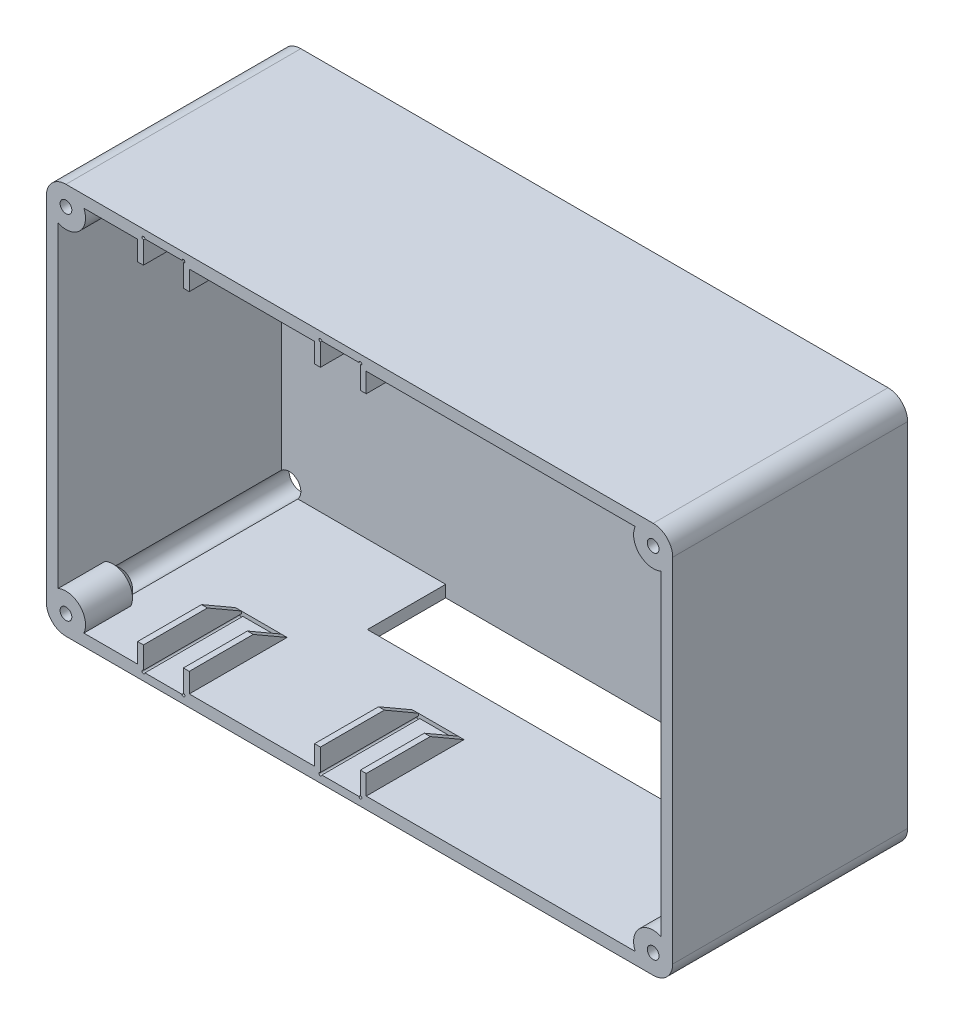
from build123d import *
from OCP.BRepFilletAPI import BRepFilletAPI_MakeChamfer

# Parameters (mm, degrees)
BASESHAPE_W                = 160
BASESHAPE_H                = 100
CONTAINERBASE_DEPTH        = 60
SIDECORNERFILLET_R         = 5
CONTAINERSHELL_T           = -3
SLOTSKETCH_W               = 10.2
SLOTSKETCH_H               = 25
SLOTCUT_DEPTH              = 1
VIEWELECTRONICSHOLE_REACH  = 199.99
ELECTRONICSVIEWHOLE_W      = 100
ELECTRONICSVIEWHOLE_H      = 20
SCREWSUPPORTS_R            = 5
BOSS_EXTRUDE3_DEPTH        = 15
SCREWSUPPORTTAPER_SIZE     = 3
SKETCH5_R                  = 3
COUNTERSINKCUT_DEPTH       = 52
SKETCH6_R                  = 1.5
SCREWHOLES_DEPTH           = 52
SKETCH7_W                  = 1.5
SKETCH7_H                  = 25
BOSS_EXTRUDE4_DEPTH        = 5
CHAMFER1_SIZE              = 8.660254038
CHAMFER1_SIZE_2            = 5
CHAMFER1_OF_MIRROR3_SIZE   = 5
CHAMFER1_OF_MIRROR3_SIZE_2 = 8.660254038
SKETCH8_R                  = 0.375
CUT_EXTRUDE1_DEPTH         = 25


with BuildPart() as part:
    # BaseShape → ContainerBase (new body)
    with BuildSketch(Plane.XY):
        with Locations((-80, -50)):
            Rectangle(BASESHAPE_W, BASESHAPE_H)
    extrude(amount=CONTAINERBASE_DEPTH)

    # SideCornerFillet
    sidecornerfillet_edges = [part.edges().sort_by_distance(p)[0] for p in [
        (0, -100, 30),
        (-160, -100, 30),
        (-160, 0, 30),
        (0, 0, 30),
    ]]
    fillet(sidecornerfillet_edges, radius=SIDECORNERFILLET_R)

    # ContainerShell
    containershell_openings = [part.faces().sort_by_distance(p)[0] for p in [
        (-80, -50, 60),
    ]]
    offset(amount=CONTAINERSHELL_T, openings=containershell_openings, kind=Kind.INTERSECTION)

    # SlotSketch → SlotCut (cut)
    with BuildSketch(Plane.XZ.offset(3)):
        with Locations((-130.1, 47.5)):
            Rectangle(SLOTSKETCH_W, SLOTSKETCH_H)
        with Locations((-84.9, 47.5)):
            Rectangle(SLOTSKETCH_W, SLOTSKETCH_H)
    slotcut = extrude(amount=-SLOTCUT_DEPTH, mode=Mode.SUBTRACT)

    # MirrorSlots: SlotCut across plane
    add(slotcut.mirror(Plane(origin=(0, -50, 0), x_dir=(0, 0, 1), z_dir=(0, -1, 0))), mode=Mode.SUBTRACT)

    # ElectronicsViewHole → ViewElectronicsHole (cut, up to next)
    with BuildSketch(Plane.XZ.offset(100), mode=Mode.PRIVATE) as viewelectronicshole_sk1:
        with Locations((-65, 13)):
            Rectangle(ELECTRONICSVIEWHOLE_W, ELECTRONICSVIEWHOLE_H)
    viewelectronicshole_tool1 = extrude(viewelectronicshole_sk1.sketch, amount=-VIEWELECTRONICSHOLE_REACH, mode=Mode.PRIVATE) & part.part
    add(viewelectronicshole_tool1.solids().sort_by_distance((-65, -100, 13))[0], mode=Mode.SUBTRACT)

    # ScrewSupports → Boss-Extrude3 (add)
    with BuildSketch(Plane.XY.offset(60)):
        with Locations((-155, -5)):
            Circle(SCREWSUPPORTS_R)
        with Locations((-155, -95)):
            Circle(SCREWSUPPORTS_R)
        with Locations((-5, -95)):
            Circle(SCREWSUPPORTS_R)
        with Locations((-5, -5)):
            Circle(SCREWSUPPORTS_R)
    extrude(amount=-BOSS_EXTRUDE3_DEPTH)

    # ScrewSupportTaper
    screwsupporttaper_edges = [part.edges().sort_by_distance(p)[0] for p in [
        (-151.464466094, -8.535533906, 45),
        (-8.535533906, -91.464466094, 45),
        (-8.535533906, -8.535533906, 45),
        (-151.464466094, -91.464466094, 45),
    ]]
    chamfer(screwsupporttaper_edges, length=SCREWSUPPORTTAPER_SIZE)

    # Sketch5 → CounterSinkCut (cut)
    with BuildSketch(Plane(origin=(0, 0, 0), x_dir=(-1, 0, 0), z_dir=(0, 0, -1))):
        with Locations((5, -5)):
            Circle(SKETCH5_R)
        with Locations((5, -95)):
            Circle(SKETCH5_R)
        with Locations((155, -95)):
            Circle(SKETCH5_R)
        with Locations((155, -5)):
            Circle(SKETCH5_R)
    extrude(amount=-COUNTERSINKCUT_DEPTH, mode=Mode.SUBTRACT)

    # Sketch6 → ScrewHoles (cut)
    with BuildSketch(Plane.XY.offset(60)):
        with Locations((-155, -5)):
            Circle(SKETCH6_R)
        with Locations((-155, -95)):
            Circle(SKETCH6_R)
        with Locations((-5, -95)):
            Circle(SKETCH6_R)
        with Locations((-5, -5)):
            Circle(SKETCH6_R)
    extrude(amount=-SCREWHOLES_DEPTH, mode=Mode.SUBTRACT)

    # Sketch7 → Boss-Extrude4 (add)
    with BuildSketch(Plane.XZ.offset(3)):
        with Locations((-135.95, 47.5)):
            Rectangle(SKETCH7_W, SKETCH7_H)
        with Locations((-124.25, 47.5)):
            Rectangle(SKETCH7_W, SKETCH7_H)
        with Locations((-90.75, 47.5)):
            Rectangle(SKETCH7_W, SKETCH7_H)
        with Locations((-79.05, 47.5)):
            Rectangle(SKETCH7_W, SKETCH7_H)
    boss_extrude4 = extrude(amount=BOSS_EXTRUDE4_DEPTH)

    # Chamfer1
    chamfer1_edges_1 = [part.edges().sort_by_distance(p)[0] for p in [
        (-135.95, -8, 35),
    ]]
    chamfer1_side_1 = [part.faces().sort_by_distance(p)[0] for p in [
        (-135.95, -8, 35.1),
    ]]
    chamfer1_edges_2 = [part.edges().sort_by_distance(p)[0] for p in [
        (-124.25, -8, 35),
    ]]
    chamfer1_side_2 = [part.faces().sort_by_distance(p)[0] for p in [
        (-124.25, -8, 35.1),
    ]]
    chamfer1_edges_3 = [part.edges().sort_by_distance(p)[0] for p in [
        (-79.05, -8, 35),
    ]]
    chamfer1_side_3 = [part.faces().sort_by_distance(p)[0] for p in [
        (-79.05, -8, 35.1),
    ]]
    chamfer1_edges_4 = [part.edges().sort_by_distance(p)[0] for p in [
        (-90.75, -8, 35),
    ]]
    chamfer1_side_4 = [part.faces().sort_by_distance(p)[0] for p in [
        (-90.75, -8, 35.1),
    ]]
    chamfer1 = BRepFilletAPI_MakeChamfer(part.part.solid().wrapped)
    for e in chamfer1_edges_1:
        chamfer1.Add(CHAMFER1_SIZE - 0.0001, CHAMFER1_SIZE_2 - 0.0001, e.wrapped, chamfer1_side_1[0].wrapped)
    for e in chamfer1_edges_2:
        chamfer1.Add(CHAMFER1_SIZE - 0.0001, CHAMFER1_SIZE_2 - 0.0001, e.wrapped, chamfer1_side_2[0].wrapped)
    for e in chamfer1_edges_3:
        chamfer1.Add(CHAMFER1_SIZE - 0.0001, CHAMFER1_SIZE_2 - 0.0001, e.wrapped, chamfer1_side_3[0].wrapped)
    for e in chamfer1_edges_4:
        chamfer1.Add(CHAMFER1_SIZE - 0.0001, CHAMFER1_SIZE_2 - 0.0001, e.wrapped, chamfer1_side_4[0].wrapped)
    add(Compound.cast(chamfer1.Shape()), mode=Mode.REPLACE)  # a hair under: the kernel refuses the full size

    # Mirror3: Boss-Extrude4 across plane
    add(boss_extrude4.mirror(Plane.ZX.offset(-50)))

    # Chamfer1 of Mirror3
    chamfer1_of_mirror3_edges_1 = [part.edges().sort_by_distance(p)[0] for p in [
        (-135.95, -92, 35),
    ]]
    chamfer1_of_mirror3_side_1 = [part.faces().sort_by_distance(p)[0] for p in [
        (-135.95, -92.1, 35),
    ]]
    chamfer1_of_mirror3_edges_2 = [part.edges().sort_by_distance(p)[0] for p in [
        (-124.25, -92, 35),
    ]]
    chamfer1_of_mirror3_side_2 = [part.faces().sort_by_distance(p)[0] for p in [
        (-124.25, -92.1, 35),
    ]]
    chamfer1_of_mirror3_edges_3 = [part.edges().sort_by_distance(p)[0] for p in [
        (-79.05, -92, 35),
    ]]
    chamfer1_of_mirror3_side_3 = [part.faces().sort_by_distance(p)[0] for p in [
        (-79.05, -92.1, 35),
    ]]
    chamfer1_of_mirror3_edges_4 = [part.edges().sort_by_distance(p)[0] for p in [
        (-90.75, -92, 35),
    ]]
    chamfer1_of_mirror3_side_4 = [part.faces().sort_by_distance(p)[0] for p in [
        (-90.75, -92.1, 35),
    ]]
    chamfer1_of_mirror3 = BRepFilletAPI_MakeChamfer(part.part.solid().wrapped)
    for e in chamfer1_of_mirror3_edges_1:
        chamfer1_of_mirror3.Add(CHAMFER1_OF_MIRROR3_SIZE - 0.0001, CHAMFER1_OF_MIRROR3_SIZE_2 - 0.0001, e.wrapped, chamfer1_of_mirror3_side_1[0].wrapped)
    for e in chamfer1_of_mirror3_edges_2:
        chamfer1_of_mirror3.Add(CHAMFER1_OF_MIRROR3_SIZE - 0.0001, CHAMFER1_OF_MIRROR3_SIZE_2 - 0.0001, e.wrapped, chamfer1_of_mirror3_side_2[0].wrapped)
    for e in chamfer1_of_mirror3_edges_3:
        chamfer1_of_mirror3.Add(CHAMFER1_OF_MIRROR3_SIZE - 0.0001, CHAMFER1_OF_MIRROR3_SIZE_2 - 0.0001, e.wrapped, chamfer1_of_mirror3_side_3[0].wrapped)
    for e in chamfer1_of_mirror3_edges_4:
        chamfer1_of_mirror3.Add(CHAMFER1_OF_MIRROR3_SIZE - 0.0001, CHAMFER1_OF_MIRROR3_SIZE_2 - 0.0001, e.wrapped, chamfer1_of_mirror3_side_4[0].wrapped)
    add(Compound.cast(chamfer1_of_mirror3.Shape()), mode=Mode.REPLACE)  # a hair under: the kernel refuses the full size

    # Sketch8 → Cut-Extrude1 (cut)
    with BuildSketch(Plane.XY.offset(60)):
        with Locations((-135.2, -2)):
            Circle(SKETCH8_R)
        with Locations((-125, -2)):
            Circle(SKETCH8_R)
        with Locations((-90, -2)):
            Circle(SKETCH8_R)
        with Locations((-79.8, -2)):
            Circle(SKETCH8_R)
        with Locations((-135.2, -98)):
            Circle(SKETCH8_R)
        with Locations((-90, -98)):
            Circle(SKETCH8_R)
        with Locations((-125, -98)):
            Circle(SKETCH8_R)
        with Locations((-79.8, -98)):
            Circle(SKETCH8_R)
    extrude(amount=-CUT_EXTRUDE1_DEPTH, mode=Mode.SUBTRACT)


solid = part.part
